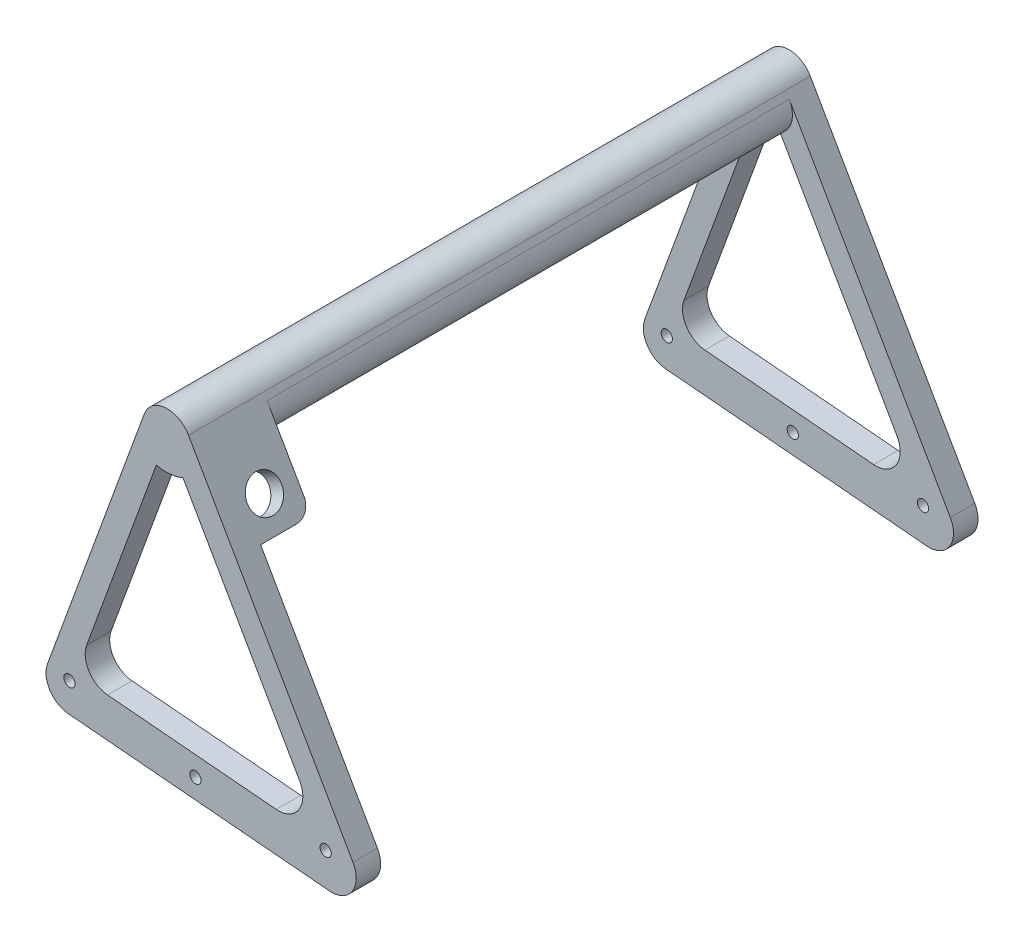
from build123d import *

# Parameters (mm, degrees)
AUFSATZ_LINEAR_AUSTRAGEN1_DEPTH = 5
AUFSATZ_LINEAR_AUSTRAGEN2_DEPTH = 5
AUFSATZ_LINEAR_AUSTRAGEN3_DEPTH = 127
VERRUNDUNG1_R                   = 5
SKIZZE4_R                       = 1.15
SCHNITT_LINEAR_AUSTRAGEN1_DEPTH = 160.018146459
VERRUNDUNG2_R                   = 5
SKIZZE5_W                       = 10.358999457
SKIZZE5_H                       = 18.2
AUFSATZ_LINEAR_AUSTRAGEN4_DEPTH = 3
SKIZZE6_R                       = 3.5
SCHNITT_LINEAR_AUSTRAGEN2_DEPTH = 146.462570096
VERRUNDUNG4_R                   = 3


with BuildPart() as part:
    # Skizze1 → Aufsatz-Linear austragen1 (new body)
    with BuildSketch(Plane.XY):
        Polygon((-19.239846421, 13.575566883), (6.456161255, 83.889632397), (50.130587288, 7.506440349), align=None)
        Polygon((-11.237544669, 20.906014898), (7.458044946, 72.064269891), (39.234154141, 16.490313423), align=None, mode=Mode.SUBTRACT)
    extrude(amount=AUFSATZ_LINEAR_AUSTRAGEN1_DEPTH)



with BuildPart() as body_2:
    # Skizze2 → Aufsatz-Linear austragen2 (new body)
    with BuildSketch(Plane(origin=(0, 0, -117), x_dir=(-1, 0, 0), z_dir=(0, 0, -1))):
        Polygon((-50.130587288, 7.506440349), (19.239846421, 13.575566883), (-6.456161255, 83.889632397), align=None)
        Polygon((-39.234154141, 16.490313423), (11.237544669, 20.906014898), (-7.458044946, 72.064269891), align=None, mode=Mode.SUBTRACT)
    extrude(amount=AUFSATZ_LINEAR_AUSTRAGEN2_DEPTH)


with BuildPart() as part_1:
    add(part.part)

    add(body_2.part)  # Aufsatz-Linear austragen3 merges body 2
    # Skizze3 → Aufsatz-Linear austragen3 (add, through all)
    with BuildSketch(Plane.XY.offset(5)):
        Polygon((6.456161255, 83.889632397), (-0.408718311, 65.10470683), (16.38354695, 66.527402895), align=None)
    extrude(amount=-AUFSATZ_LINEAR_AUSTRAGEN3_DEPTH)

    # Verrundung1
    verrundung1_edges = [part_1.edges().sort_by_distance(p)[0] for p in [
        (-11.237544669, 20.906014898, 2.5),
        (39.234154141, 16.490313423, 2.5),
        (50.130587288, 7.506440349, -119.5),
        (-19.239846421, 13.575566883, -119.5),
        (39.234154141, 16.490313423, -119.5),
        (-11.237544669, 20.906014898, -119.5),
        (-19.239846421, 13.575566883, 2.5),
        (50.130587288, 7.506440349, 2.5),
    ]]
    fillet(verrundung1_edges, radius=VERRUNDUNG1_R)

    # Skizze4 → Schnitt-Linear austragen1 (cut, through all)
    with BuildSketch(Plane.XY.offset(5)):
        with Locations((-12.521530051, 18.969329152)):
            Circle(SKIZZE4_R)
        with Locations(Location((39.809827396, 15.116890366, 0), (0, 0, 180))):
            Circle(SKIZZE4_R)
        with Locations(Location((13.212061367, 14.751672192, 0), (0, 0, 180))):
            Circle(SKIZZE4_R)
    extrude(amount=-SCHNITT_LINEAR_AUSTRAGEN1_DEPTH, mode=Mode.SUBTRACT)

    # Verrundung2
    # the kernel refuses this fillet: 5 mm, written as the material it takes off along each edge
    with BuildSketch(Plane(origin=(6.456161255, 83.889632397, 31.907592949), x_dir=(-0.34324397830304476, -0.9392462783310345, 0), z_dir=(0, 0, -1))) as verrundung2_piece_1:
        with BuildLine():
            CenterArc((VERRUNDUNG2_R * 2.15260743589, -VERRUNDUNG2_R), VERRUNDUNG2_R, 90, 130.165278403)
            Line((VERRUNDUNG2_R * 1.38842039617, -VERRUNDUNG2_R * 1.64499470411), (0, 0))
            Line((0, 0), (VERRUNDUNG2_R * 2.15260743589, 0))
        make_face()
    extrude(amount=180.815185897, mode=Mode.SUBTRACT)
    with BuildSketch(Plane(origin=(-0.408718311, 65.10470683, 19.589879441), x_dir=(0.34324397830304404, 0.9392462783310347, 0), z_dir=(0, 0, -1))) as verrundung2_piece_2_section:
        with BuildLine():
            CenterArc((VERRUNDUNG2_R * 1.56719035525, VERRUNDUNG2_R), VERRUNDUNG2_R, 155.082639201, 114.917360799)
            Line((VERRUNDUNG2_R * 0.660273957752, VERRUNDUNG2_R * 1.42131063118), (0, 0))
            Line((0, 0), (VERRUNDUNG2_R * 1.56719035525, 0))
        make_face()
    verrundung2_piece_2 = extrude(amount=156.179758881, mode=Mode.PRIVATE)
    verrundung2_piece_2 = split(verrundung2_piece_2, bisect_by=Plane(origin=(5.223636013, 65.950075885, 2.5), z_dir=(0.9392462783310345, -0.34324397830304465, 0)), keep=Keep.TOP, mode=Mode.PRIVATE)
    add(verrundung2_piece_2, mode=Mode.SUBTRACT)
    with BuildSketch(Plane(origin=(-0.408718311, 65.10470683, 0), x_dir=(0.34324397830304504, 0.9392462783310342, 0), z_dir=(0, 0, -1)), Plane(origin=(16.38354695, 66.527402895, 0), x_dir=(-0.9964301882569208, -0.08442085009212626, 0), z_dir=(0, 0, -1))) as verrundung2_piece_3:
        with BuildLine():
            CenterArc((VERRUNDUNG2_R * 1.56719035525, VERRUNDUNG2_R), VERRUNDUNG2_R, 155.082639201, 114.917360799)
            Line((VERRUNDUNG2_R * 0.660273957752, VERRUNDUNG2_R * 1.42131063118), (0, 0))
            Line((0, 0), (VERRUNDUNG2_R * 1.56719035525, 0))
        make_face()
    extrude(amount=117, mode=Mode.SUBTRACT)
    with BuildSketch(Plane(origin=(16.38354695, 66.527402895, 19.589879441), x_dir=(-0.9964301882569208, -0.08442085009212626, 0), z_dir=(0, 0, -1))) as verrundung2_piece_4_section:
        with BuildLine():
            CenterArc((VERRUNDUNG2_R * 1.56719035525, VERRUNDUNG2_R), VERRUNDUNG2_R, 155.082639201, 114.917360799)
            Line((VERRUNDUNG2_R * 0.660273957752, VERRUNDUNG2_R * 1.42131063118), (0, 0))
            Line((0, 0), (VERRUNDUNG2_R * 1.56719035525, 0))
        make_face()
    verrundung2_piece_4 = extrude(amount=156.179758881, mode=Mode.PRIVATE)
    verrundung2_piece_4 = split(verrundung2_piece_4, bisect_by=Plane(origin=(10.689250835, 66.413140789, 2.5), z_dir=(-0.868111475056711, -0.4963692847818663, 0)), keep=Keep.TOP, mode=Mode.PRIVATE)
    add(verrundung2_piece_4, mode=Mode.SUBTRACT)

    # Skizze5 → Aufsatz-Linear austragen4 (add)
    with BuildSketch(Plane(origin=(41.013843737, 23.450919458, 0), x_dir=(0, 0, -1), z_dir=(0.868111475056711, 0.4963692847818664, 0))):
        with Locations((5.179499729, 48.356864154)):
            Rectangle(SKIZZE5_W, SKIZZE5_H)
    extrude(amount=-AUFSATZ_LINEAR_AUSTRAGEN4_DEPTH)

    # Skizze6 → Schnitt-Linear austragen2 (cut, through all)
    with BuildSketch(Plane(origin=(41.013843737, 23.450919458, 0), x_dir=(0, 0, -1), z_dir=(0.868111475056711, 0.4963692847818664, 0))):
        with Locations(Location((3.929999457, 45.606864154, 0), (0, 0, 90))):
            Circle(SKIZZE6_R)
    extrude(amount=-SCHNITT_LINEAR_AUSTRAGEN2_DEPTH, mode=Mode.SUBTRACT)

    # Verrundung4
    verrundung4_edges = [part_1.edges().sort_by_distance(p)[0] for p in [
        (20.225774942, 56.785699777, -10.358999457),
    ]]
    fillet(verrundung4_edges, radius=VERRUNDUNG4_R)


solid = part_1.part
